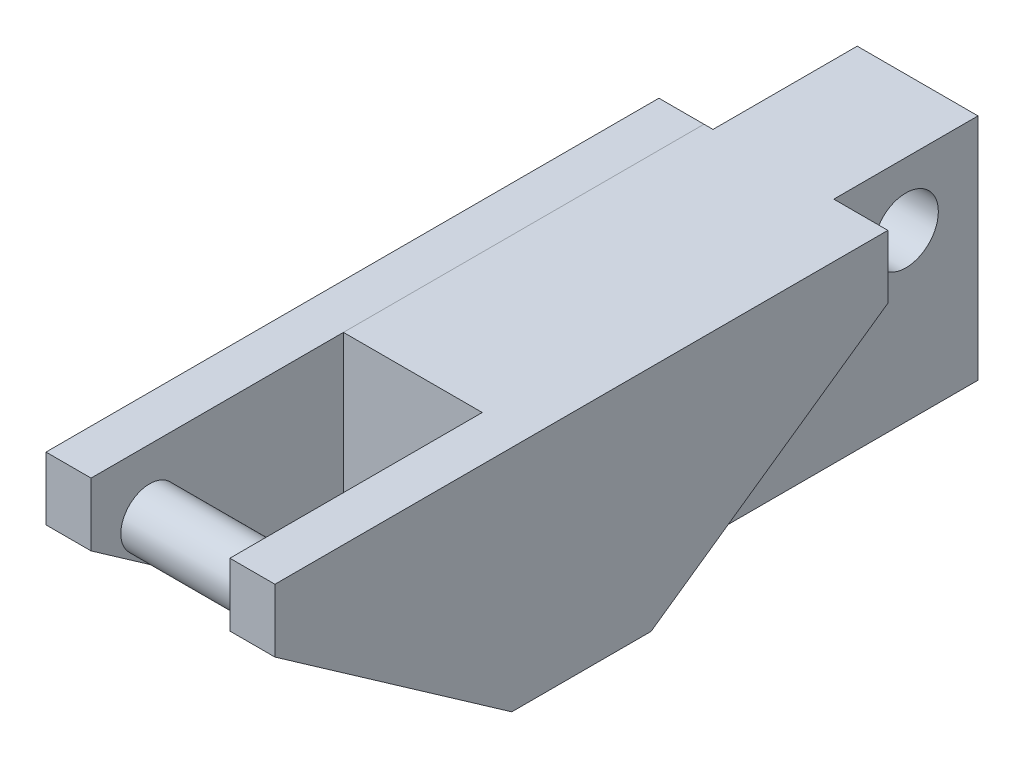
from build123d import *

# Parameters (mm, degrees)
BOSS_EXTRUDE1_DEPTH    = 12.7
SKETCH3_R              = 1.8
CUT_EXTRUDE1_DEPTH     = 42.157547255
BOSS_EXTRUDE4_REACH    = 64.236
BOSS_EXTRUDE4_START    = -21.07817965
SKETCH3_3_R            = 1.6
CUT_EXTRUDE19_DEPTH    = 3
SPLIT1_SURFACE_1_BACK  = 46.679
SPLIT1_SURFACE_1_DEPTH = 93.358
SPLIT1_SURFACE_2_BACK  = 46.679
SPLIT1_SURFACE_2_DEPTH = 93.358


with BuildPart() as part:
    # Sketch2 → Boss-Extrude1 (new body)
    with BuildSketch(Plane(origin=(0, 0, 0), x_dir=(1, 0, 0), z_dir=(0, 1, 0))):
        Polygon((-28.27817965, 15.54419618), (-31.27817965, 15.54419618), (-31.27817965, -18.45580382), (-28.77817965, -18.45580382), (-28.77817965, -4.45580382), (-21.07817965, -4.45580382), (-21.07817965, -18.45580382), (-18.57817965, -18.45580382), (-18.57817965, 15.54419618), (-21.57817965, 15.54419618), (-21.57817965, 23.54419618), (-28.27817965, 23.54419618), align=None)
    extrude(amount=BOSS_EXTRUDE1_DEPTH)

    # Sketch3 → Cut-Extrude1 (cut, through all)
    with BuildSketch(Plane(origin=(0, 0, 0), x_dir=(0, 0, -1), z_dir=(1, 0, 0))):
        with Locations((19.54419618, 9.2)):
            Circle(SKETCH3_R)
    extrude(amount=-CUT_EXTRUDE1_DEPTH, mode=Mode.SUBTRACT)

    # Sketch3<3> → Boss-Extrude4 (add, up to next)
    with BuildSketch(Plane(origin=(0, 0, 0), x_dir=(0, 0, -1), z_dir=(1, 0, 0)).offset(BOSS_EXTRUDE4_START), mode=Mode.PRIVATE) as boss_extrude4_sk1:
        with Locations((-15.20580382, 9.2)):
            Circle(SKETCH3_3_R)
    boss_extrude4_tool1 = extrude(boss_extrude4_sk1.sketch, amount=-BOSS_EXTRUDE4_REACH, mode=Mode.PRIVATE) - part.part
    add(boss_extrude4_tool1.solids().sort_by_distance((-21.07818, 9.2, 15.205804))[0])

    # Sketch38 → Cut-Extrude19 (cut)
    with BuildSketch(Plane(origin=(-18.57817965, 0, 0), x_dir=(0, 0, -1), z_dir=(1, 0, 0))):
        Polygon((2.405234518, 0), (15.54419618, 0), (15.54419618, 9.2), align=None)
        Polygon((-5.316842158, 0), (-18.45580382, 0), (-18.45580382, 9.2), align=None)
    cut_extrude19 = extrude(amount=-CUT_EXTRUDE19_DEPTH, mode=Mode.SUBTRACT)

    # Mirror10: Cut-Extrude19 across plane
    add(cut_extrude19.mirror(Plane.ZY.offset(24.92817965)), mode=Mode.SUBTRACT)


with BuildPart() as body_2:
    # Split1: the piece behind the surface
    add(part.part)
    # Split1 surface: a surface, the sketch's curves swept straight by 93.358 mm
    with BuildLine(Plane(origin=(0, 12.7, 0), x_dir=(1, 0, 0), z_dir=(0, 1, 0)).offset(-SPLIT1_SURFACE_1_BACK), mode=Mode.PRIVATE) as split1_surface_1_path:
        Line((-28.77817965, -18.45580382), (-28.77817965, 15.54419618))
    split1_surface_1 = Shell.extrude(split1_surface_1_path.wire(), (0 * SPLIT1_SURFACE_1_DEPTH, 1 * SPLIT1_SURFACE_1_DEPTH, 0 * SPLIT1_SURFACE_1_DEPTH))
    split(bisect_by=split1_surface_1, keep=Keep.BOTTOM)


with BuildPart() as part_1:
    add(part.part)

    # Split1: split by a surface, the side it looks to stays
    # Split1 surface: a surface, the sketch's curves swept straight by 93.358 mm
    with BuildLine(Plane(origin=(0, 12.7, 0), x_dir=(1, 0, 0), z_dir=(0, 1, 0)).offset(-SPLIT1_SURFACE_2_BACK), mode=Mode.PRIVATE) as split1_surface_2_path:
        Line((-28.77817965, -18.45580382), (-28.77817965, 15.54419618))
    split1_surface_2 = Shell.extrude(split1_surface_2_path.wire(), (0 * SPLIT1_SURFACE_2_DEPTH, 1 * SPLIT1_SURFACE_2_DEPTH, 0 * SPLIT1_SURFACE_2_DEPTH))
    split(bisect_by=split1_surface_2, keep=Keep.TOP)


solid = Compound([body_2.part, part_1.part])
